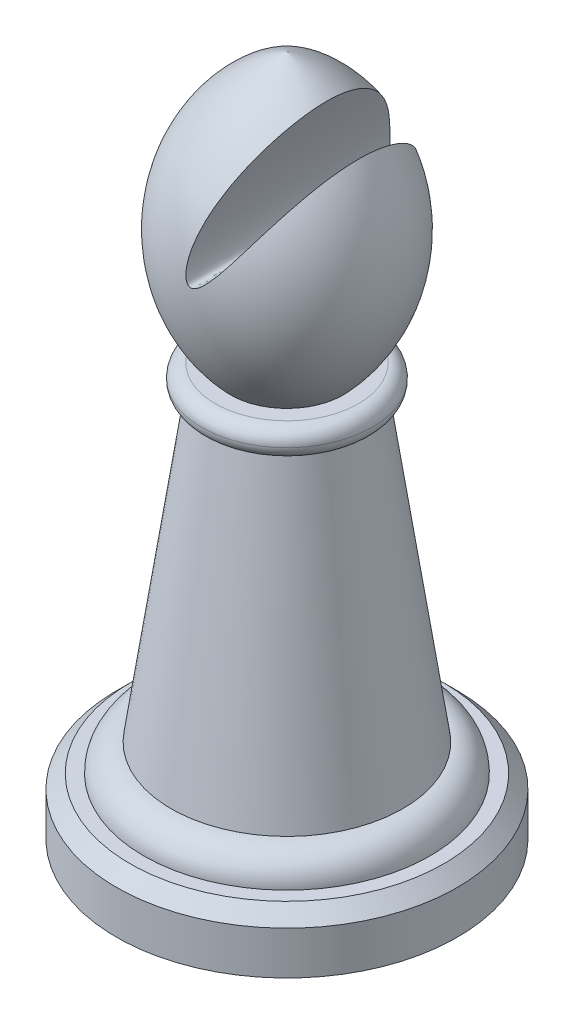
from build123d import *

# Parameters (mm, degrees)
FILLET1_R               = 0.762
FILLET2_R               = 1.524
CHAMFER1_SIZE           = 0.762
CUT_EXTRUDE1_DEPTH      = 41.411152639
CUT_EXTRUDE1_DEPTH_BACK = 41.411152639
SKETCH4_RX              = 6.8453
SKETCH4_RY              = 1.2192


# Some blends are built 0.0001 mm under size
with BuildPart() as part:
    # Sketch2 → Revolve1 (revolve)
    with BuildSketch(Plane.XY, mode=Mode.PRIVATE) as revolve1_sk:
        with BuildLine():
            Line((0, 0), (-9.525, 0))
            Line((-9.525, 0), (-9.525, 3.175))
            Line((-9.525, 3.175), (-8.001, 3.175))
            Line((-8.001, 3.175), (-8.001, 4.699))
            Line((-8.001, 4.699), (-6.477, 4.699))
            Line((-6.477, 4.699), (-4.0386, 21.5392))
            Line((-4.0386, 21.5392), (-4.7625, 21.5392))
            Line((-4.7625, 21.5392), (-4.7625, 23.0632))
            Line((-4.7625, 23.0632), (-3.1496, 23.0632))
            ThreePointArc((-3.1496, 23.0632), (-5.550091148, 31.414262335), (0, 38.1))
            Line((0, 38.1), (0, 0))
        make_face()
    revolve(revolve1_sk.sketch.rotate(Axis((0, 0, 0), (0, 1, 0)), 270), axis=Axis((0, 0, 0), (0, 1, 0)))

    # Fillet1
    # the kernel refuses this fillet: 0.762 mm, written as the material it takes off along each edge
    with BuildSketch(Plane(origin=(0, 21.5392, 0), x_dir=(0, 0, -1), z_dir=(1, 0, 0))) as fillet1_piece_1:
        with BuildLine():
            CenterArc((4.0005, 0.761046904), FILLET1_R, 272.865983983, 87.134016017)
            Line((4.7625, 0.761046904), (4.7625, 0))
            Line((4.7625, 0), (4.0386, 0))
        make_face()
    revolve(axis=Axis((0, 21.5392, 0), (0, 1, 0)), mode=Mode.SUBTRACT)
    with BuildSketch(Plane(origin=(0, 23.0632, 0), x_dir=(0, 0, -1), z_dir=(1, 0, 0))) as fillet1_piece_2:
        with BuildLine():
            CenterArc((4.7625 - FILLET1_R, -FILLET1_R), FILLET1_R, 0, 90)
            Line((4.7625 - FILLET1_R, 0), (4.7625, 0))
            Line((4.7625, 0), (4.7625, -FILLET1_R))
        make_face()
    revolve(axis=Axis((0, 23.0632, 0), (0, 1, 0)), mode=Mode.SUBTRACT)

    # Fillet2
    fillet2_edges = [part.edges().sort_by_distance(p)[0] for p in [
        (0, 4.699, 8.001),
    ]]
    fillet(fillet2_edges, radius=FILLET2_R - 0.0001)  # a hair under: the kernel refuses the full size

    # Chamfer1
    chamfer1_edges = [part.edges().sort_by_distance(p)[0] for p in [
        (0, 3.175, 9.525),
    ]]
    chamfer(chamfer1_edges, length=CHAMFER1_SIZE)

    # Sketch4 → Cut-Extrude1 (cut, two sides: drawn at the far end of the back side and taken through both)
    with BuildSketch(Plane.XY.offset(-CUT_EXTRUDE1_DEPTH_BACK)):
        with Locations(Location((3.154122701, 35.949567736), (0, 0, 65.082449179))):
            Ellipse(SKETCH4_RX, SKETCH4_RY)
    extrude(amount=CUT_EXTRUDE1_DEPTH + CUT_EXTRUDE1_DEPTH_BACK, mode=Mode.SUBTRACT)


solid = part.part
